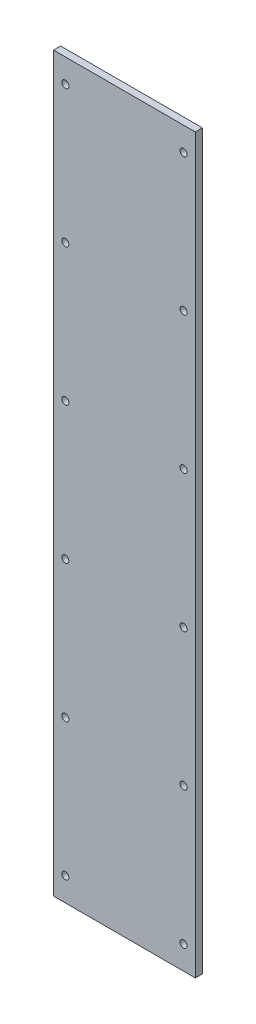
from build123d import *

# Parameters (mm, degrees)
ESQUISSE1_R        = 1.5
BOSS_EXTRU_1_DEPTH = 3


with BuildPart() as part:
    # Esquisse1 → Boss.-Extru.1 (new body)
    with BuildSketch(Plane.XY):
        Polygon((-20, -155), (30, -155), (30, 155), (-20, 155), (-30, 155), (-30, 150), (-30, -150), (-30, -155), align=None)
        with Locations((-25, -145)):
            Circle(ESQUISSE1_R, mode=Mode.SUBTRACT)
        with Locations((-25, -87)):
            Circle(ESQUISSE1_R, mode=Mode.SUBTRACT)
        with Locations((-25, -29)):
            Circle(ESQUISSE1_R, mode=Mode.SUBTRACT)
        with Locations((25, -145)):
            Circle(ESQUISSE1_R, mode=Mode.SUBTRACT)
        with Locations((25, -87)):
            Circle(ESQUISSE1_R, mode=Mode.SUBTRACT)
        with Locations((25, -29)):
            Circle(ESQUISSE1_R, mode=Mode.SUBTRACT)
        with Locations((-25, 29)):
            Circle(ESQUISSE1_R, mode=Mode.SUBTRACT)
        with Locations((-25, 87)):
            Circle(ESQUISSE1_R, mode=Mode.SUBTRACT)
        with Locations((-25, 145)):
            Circle(ESQUISSE1_R, mode=Mode.SUBTRACT)
        with Locations((25, 29)):
            Circle(ESQUISSE1_R, mode=Mode.SUBTRACT)
        with Locations((25, 87)):
            Circle(ESQUISSE1_R, mode=Mode.SUBTRACT)
        with Locations((25, 145)):
            Circle(ESQUISSE1_R, mode=Mode.SUBTRACT)
    extrude(amount=BOSS_EXTRU_1_DEPTH)


solid = part.part
